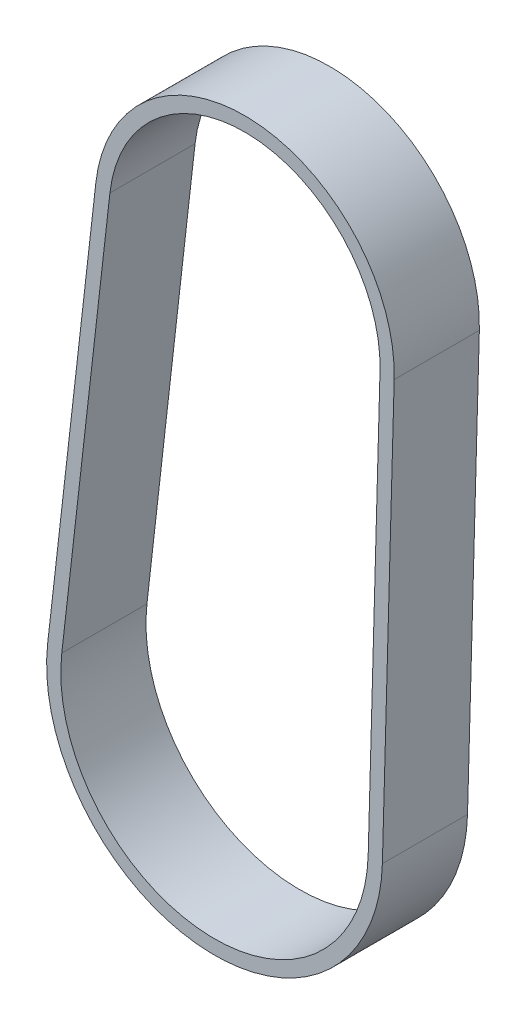
from build123d import *

# Parameters (mm, degrees)
EXTRUDE_THIN1_DEPTH = 9


with BuildPart() as part:
    # Sketch2 → Extrude-Thin1 (new body)
    with BuildSketch(Plane.XY):
        with BuildLine():
            Line((15.817830617, -0.439847777), (14.568141525, -45.381237528))
            ThreePointArc((14.568141525, -45.381237528), (-4.427361134, -62.593616825), (-20.810936342, -42.878810567))
            Line((-20.810936342, -42.878810567), (-15.722258285, 1.791040465))
            ThreePointArc((-15.722258285, 1.791040465), (1.116467243, 15.784509255), (15.817830617, -0.439847777))
        make_face()
        with BuildLine():
            Line((14.318410207, -0.398153265), (13.068721115, -45.339543016))
            ThreePointArc((13.068721115, -45.339543016), (-4.321527799, -61.097355048), (-19.320575524, -43.048588756))
            Line((-19.320575524, -43.048588756), (-14.231897467, 1.621262276))
            ThreePointArc((-14.231897467, 1.621262276), (1.010633908, 14.288247478), (14.318410207, -0.398153265))
        make_face(mode=Mode.SUBTRACT)
    extrude(amount=EXTRUDE_THIN1_DEPTH)


solid = part.part
